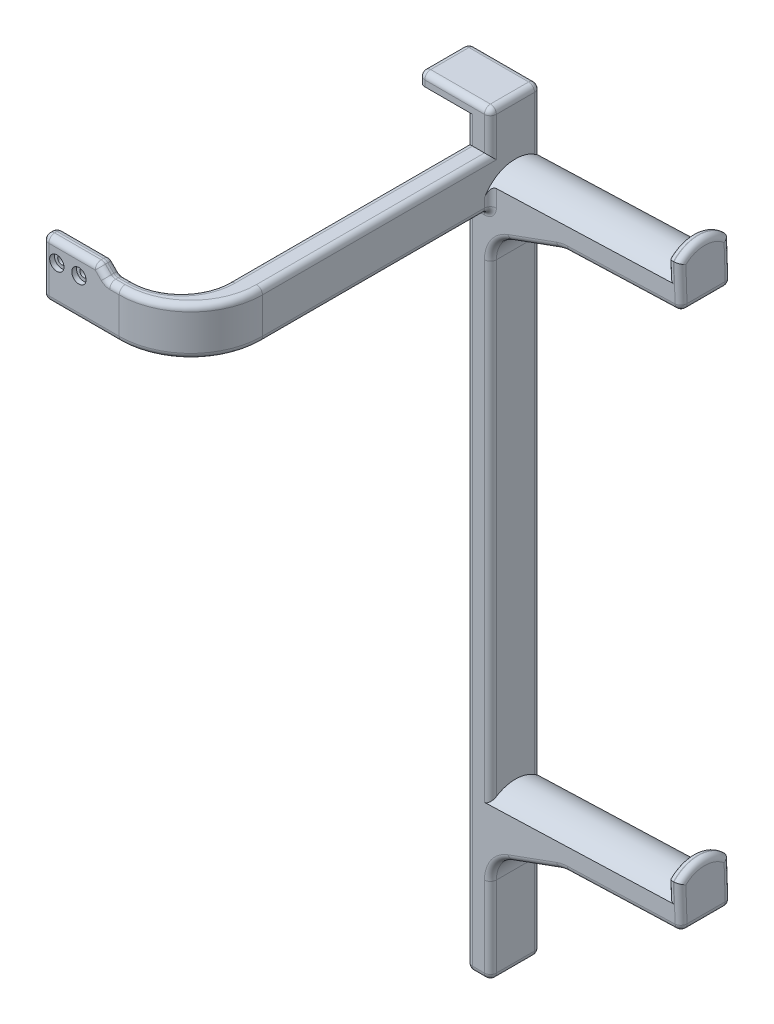
from build123d import *

# Parameters (mm, degrees)
SKETCH2_W                = 21
SKETCH2_H                = 24
SKETCH2_R                = 1.625
BOSS_EXTRUDE1_DEPTH      = 6
SKETCH4_W                = 31
SKETCH4_H                = 20
BOSS_EXTRUDE3_DEPTH      = 6
BOSS_EXTRUDE4_DEPTH      = 10
FILLET3_R                = 20
FILLET4_R                = 30
BOSS_EXTRUDE7_DEPTH      = 11.5
BOSS_EXTRUDE7_DEPTH_BACK = 300
SKETCH9_W                = 10
SKETCH9_H                = 21
BOSS_EXTRUDE9_DEPTH      = 80
BOSS_EXTRUDE6_DEPTH      = 5.2
LPATTERN1_COUNT          = 2
LPATTERN1_PITCH          = 225
SKETCH10_W               = 30
SKETCH10_H               = 21
BOSS_EXTRUDE8_DEPTH      = 5
CHAMFER1_SIZE            = 6
CHAMFER2_SIZE            = 10
CHAMFER2_SIZE_2          = 30.409091988
FILLET2_R                = 12.5
FILLET1_R                = 2.5
SKETCH12_R               = 3
CUT_EXTRUDE2_DEPTH       = 2


with BuildPart() as part:
    # Sketch2 → Boss-Extrude1 (new body)
    with BuildSketch(Plane.XY):
        with Locations((0, -4)):
            Rectangle(SKETCH2_W, SKETCH2_H)
        with Locations((-4.625, 0)):
            Circle(SKETCH2_R, mode=Mode.SUBTRACT)
        with Locations((4.625, 0)):
            Circle(SKETCH2_R, mode=Mode.SUBTRACT)
    extrude(amount=-BOSS_EXTRUDE1_DEPTH)

    # Sketch4 → Boss-Extrude3 (add)
    with BuildSketch(Plane.XY):
        with Locations((26, -6)):
            Rectangle(SKETCH4_W, SKETCH4_H)
    extrude(amount=-BOSS_EXTRUDE3_DEPTH)

    # Sketch5 → Boss-Extrude4 (add)
    with BuildSketch(Plane(origin=(41.5, 0, 0), x_dir=(0, 0, -1), z_dir=(1, 0, 0))):
        Polygon((0, 4), (136, 4), (146.5, 4), (146.5, -16), (136, -16), (0, -16), align=None)
    extrude(amount=BOSS_EXTRUDE4_DEPTH)

    # Fillet3
    fillet3_edges = [part.edges().sort_by_distance(p)[0] for p in [
        (41.5, -6, -6),
    ]]
    fillet(fillet3_edges, radius=FILLET3_R)

    # Fillet4
    fillet4_edges = [part.edges().sort_by_distance(p)[0] for p in [
        (51.5, -6, 0),
    ]]
    fillet(fillet4_edges, radius=FILLET4_R)

    # Sketch9 → Boss-Extrude7 (add, two sides: drawn at the far end of the back side and taken through both)
    with BuildSketch(Plane(origin=(0, 4, 0), x_dir=(1, 0, 0), z_dir=(0, 1, 0)).offset(-BOSS_EXTRUDE7_DEPTH_BACK)):
        with Locations((46.5, 136)):
            Rectangle(SKETCH9_W, SKETCH9_H)
    extrude(amount=BOSS_EXTRUDE7_DEPTH + BOSS_EXTRUDE7_DEPTH_BACK)

    # Sketch7 → Boss-Extrude9 (add)
    with BuildSketch(Plane(origin=(50.970695423, -0.84270008, 0), x_dir=(0, 0, -1), z_dir=(0.9993908270190962, 0.0348994967024875, 0))):
        with BuildLine():
            Line((146.5, -15.166538966), (125.5, -15.166538966))
            Line((125.5, -15.166538966), (125.5, -5.666538966))
            ThreePointArc((125.5, -5.666538966), (136, -1.317296561), (146.5, -5.666538966))
            Line((146.5, -5.666538966), (146.5, -15.166538966))
        make_face()
    boss_extrude9 = extrude(amount=BOSS_EXTRUDE9_DEPTH)

    # Sketch8 → Boss-Extrude6 (add)
    with BuildSketch(Plane(origin=(130.906846664, 2.382094355, 0), x_dir=(0, 0, -1), z_dir=(0.9993908270190963, 0.034899496702487515, 0))):
        with BuildLine():
            Line((146.5, -15.599637496), (125.5, -15.599637496))
            Line((125.5, -15.599637496), (125.5, 1.900362504))
            ThreePointArc((125.5, 1.900362504), (136, 6.249604909), (146.5, 1.900362504))
            Line((146.5, 1.900362504), (146.5, -15.599637496))
        make_face()
    boss_extrude6 = extrude(amount=-BOSS_EXTRUDE6_DEPTH)

    # LPattern1: Boss-Extrude9, Boss-Extrude6 ×2
    with Locations(*[(0, -i * LPATTERN1_PITCH, 0) for i in range(1, LPATTERN1_COUNT)]):
        add(boss_extrude9)
        add(boss_extrude6)

    # Sketch10 → Boss-Extrude8 (add)
    with BuildSketch(Plane(origin=(0, 15.5, 0), x_dir=(1, 0, 0), z_dir=(0, 1, 0))):
        with Locations((36.5, 136)):
            Rectangle(SKETCH10_W, SKETCH10_H)
    extrude(amount=BOSS_EXTRUDE8_DEPTH)

    # Chamfer1
    # the kernel refuses this chamfer: 6 mm, written as the material it adds along each edge
    with BuildSketch(Plane(origin=(10.5, 4, 0), x_dir=(-0.02749587661058822, 0.9996219169112968, 0), z_dir=(0, 0, -1))) as chamfer1_piece_1_section:
        Polygon((CHAMFER1_SIZE * 0.999621916911, CHAMFER1_SIZE * 0.0274958766106), (-CHAMFER1_SIZE * 0.0274958766106, CHAMFER1_SIZE * 0.999621916911), (0, 0), align=None)
    chamfer1_piece_1 = extrude(amount=6, mode=Mode.PRIVATE)
    chamfer1_piece_1 = split(chamfer1_piece_1, bisect_by=Plane(origin=(12.68418201, 8, -3), z_dir=(0, -1, 0)), keep=Keep.TOP, mode=Mode.PRIVATE)
    add(chamfer1_piece_1)

    # Chamfer2
    # the kernel refuses this chamfer: 30.409091988, 10 mm, written as the material it adds along each edge
    with BuildSketch(Plane(origin=(51.5, -241, -146.5), x_dir=(-0.10908076441765038, -0.9940328902174521, 0), z_dir=(0, 0, 1)), Plane(origin=(51.5, -16, -146.5), x_dir=(-0.10908076441765042, -0.9940328902174521, 0), z_dir=(0, 0, 1))) as chamfer2_piece_1:
        Polygon((CHAMFER2_SIZE * 0.994032890217, CHAMFER2_SIZE * 0.109080764418), (-CHAMFER2_SIZE_2 * 0.143705562938, CHAMFER2_SIZE_2 * 0.989620488466), (0, 0), align=None)
    extrude(amount=21)

    # Fillet2
    fillet2_edges = [part.edges().sort_by_distance(p)[0] for p in [
        (81.890567591, -239.938737994, -136),
        (51.5, -251, -136),
        (81.890567591, -14.938737994, -136),
        (51.5, -26, -136),
    ]]
    fillet(fillet2_edges, radius=FILLET2_R)

    # Fillet1
    fillet1_edges = [part.edges().sort_by_distance(p)[0] for p in [
        (130.688738598, 8.627892173, -136),
        (125.783290656, 0.102258518, -146.5),
        (125.783290656, 0.102258518, -125.5),
        (125.491906298, 8.44641479, -136),
        (-10.5, -4, -6),
        (51.5, -133.123401778, -125.5),
        (51.5, -133.123401778, -146.5),
        (107.660216606, -239.038842021, -146.5),
        (107.660216606, -239.038842021, -125.5),
        (131.145895565, -229.463370527, -146.5),
        (131.145895565, -229.463370527, -125.5),
        (131.451266162, -238.208040264, -136),
        (130.688738598, -216.372107827, -136),
        (125.783290656, -224.897741482, -146.5),
        (125.783290656, -224.897741482, -125.5),
        (125.491906298, -216.55358521, -136),
        (5.5, -16, -6),
        (21.5, 18, -146.5),
        (21.5, 18, -125.5),
        (51.5, 20.5, -136),
        (36.5, 20.5, -146.5),
        (21.5, 20.5, -136),
        (36.5, 20.5, -125.5),
        (16.5, 4, -3),
        (14.5, 6, 0),
        (12.5, 8, -3),
        (14.5, 6, -6),
        (69.877453588, -244.311153912, -125.5),
        (69.877453588, -244.311153912, -146.5),
        (69.877453588, -19.311153912, -125.5),
        (69.877453588, -19.311153912, -146.5),
        (53.760599446, -252.582888773, -125.5),
        (53.760599446, -252.582888773, -146.5),
        (81.920298318, -240.091689323, -146.5),
        (81.920298318, -240.091689323, -125.5),
        (53.760599446, -27.582888773, -125.5),
        (53.760599446, -27.582888773, -146.5),
        (81.920298318, -15.091689323, -146.5),
        (81.920298318, -15.091689323, -125.5),
        (41.5, -140.25, -146.5),
        (51.5, -277.876297114, -146.5),
        (5.5, -16, 0),
        (41.5, -16, -75.75),
        (19, 4, -6),
        (35.642135624, 4, -11.857864376),
        (-10.5, -4, 0),
        (35.642135624, -16, -11.857864376),
        (1, 8, 0),
        (51.5, -16, -77.75),
        (42.713203436, -16, -8.786796564),
        (19, 4, 0),
        (42.713203436, 4, -8.786796564),
        (51.5, 4, -77.75),
        (41.5, 4, -75.75),
        (51.5, -296, -136),
        (41.5, -156, -125.5),
        (41.5, -296, -136),
        (51.5, -277.876297114, -125.5),
        (46.5, -16, -125.5),
        (46.5, -296, -125.5),
        (46.5, -296, -146.5),
        (51.5, 12.25, -125.5),
        (41.5, 9.75, -125.5),
        (-10.5, -16, -3),
        (-10.5, 8, -3),
        (1, 8, -6),
        (51.5, 7.002895335, -146.5),
        (51.5, -11.247104665, -125.5),
        (107.660216606, -14.038842021, -146.5),
        (107.660216606, -14.038842021, -125.5),
        (131.145895565, -4.463370527, -146.5),
        (131.145895565, -4.463370527, -125.5),
        (131.451266162, -13.208040264, -136),
    ]]
    fillet(fillet1_edges, radius=FILLET1_R)

    # Sketch12 → Cut-Extrude2 (cut)
    with BuildSketch(Plane.XY):
        with Locations((-4.625, 0)):
            Circle(SKETCH12_R)
        with Locations((4.625, 0)):
            Circle(SKETCH12_R)
    extrude(amount=-CUT_EXTRUDE2_DEPTH, mode=Mode.SUBTRACT)


solid = part.part
